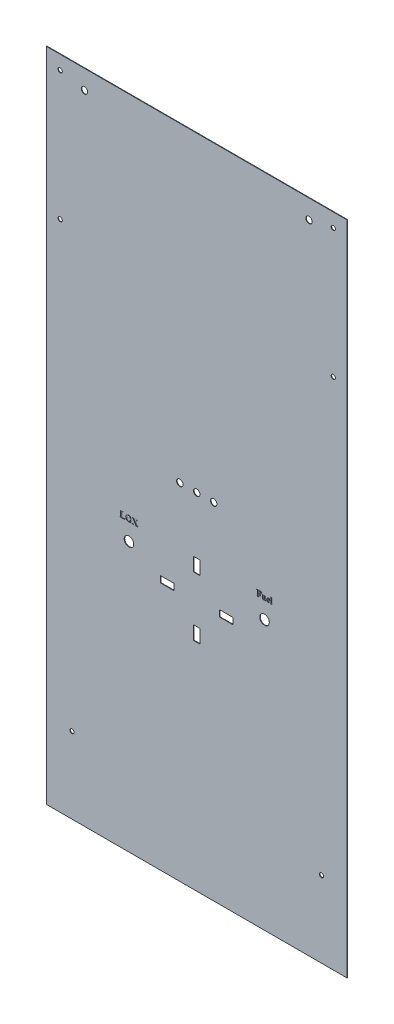
from build123d import *

# Parameters (mm, degrees)
SKETCH1_W           = 901.7
SKETCH1_H           = 1968.5
SKETCH1_R           = 6.35
BOSS_EXTRUDE1_DEPTH = 1.5875
SKETCH2_R           = 14.2875
SKETCH2_W           = 19.05
SKETCH2_H           = 40.64
SKETCH2_W_2         = 40.64
SKETCH2_H_2         = 19.05
CUT_EXTRUDE1_DEPTH  = 1083.597018819
WRAP1_START         = -3.81
WRAP1_DEPTH         = 1.27
SKETCH4_R           = 9.525
CUT_EXTRUDE4_DEPTH  = 22.86
SKETCH6_R           = 9.525
CUT_EXTRUDE5_DEPTH  = 2.54


# Read off the part's stored shape, not the designer's step: Wrap1
with BuildPart() as part:
    # Sketch1 → Boss-Extrude1 (new body)
    with BuildSketch(Plane.XY):
        Rectangle(SKETCH1_W, SKETCH1_H)
        with Locations((-409.447415534, 942.65240495)):
            Circle(SKETCH1_R, mode=Mode.SUBTRACT)
        with Locations((-409.447415534, 555.94759505)):
            Circle(SKETCH1_R, mode=Mode.SUBTRACT)
        with Locations((-374.018387972, -755.65)):
            Circle(SKETCH1_R, mode=Mode.SUBTRACT)
        with Locations(Location((374.018387972, -755.65, 0), (0, 0, 180))):
            Circle(SKETCH1_R, mode=Mode.SUBTRACT)
        with Locations(Location((409.447415534, 555.94759505, 0), (0, 0, 180))):
            Circle(SKETCH1_R, mode=Mode.SUBTRACT)
        with Locations(Location((409.447415534, 942.65240495, 0), (0, 0, 180))):
            Circle(SKETCH1_R, mode=Mode.SUBTRACT)
    extrude(amount=BOSS_EXTRUDE1_DEPTH)

    # Sketch2 → Cut-Extrude1 (cut, through all)
    with BuildSketch(Plane(origin=(0, 0, 0), x_dir=(-1, 0, 0), z_dir=(0, 0, -1))):
        with Locations((203.2, -177.8)):
            Circle(SKETCH2_R)
        with Locations((-203.2, -177.8)):
            Circle(SKETCH2_R)
        with Locations((0, -139.7)):
            Rectangle(SKETCH2_W, SKETCH2_H)
        with Locations((-88.9, -228.6)):
            Rectangle(SKETCH2_W_2, SKETCH2_H_2)
        with Locations((88.9, -228.6)):
            Rectangle(SKETCH2_W_2, SKETCH2_H_2)
        with Locations((0, -317.5)):
            Rectangle(SKETCH2_W, SKETCH2_H)
    extrude(amount=-CUT_EXTRUDE1_DEPTH, mode=Mode.SUBTRACT)

    # Wrap1 outline → Wrap1 (cut)
    # profile 1 of 7: a face of its own
    with BuildSketch(Plane.XY.offset(4.1275).offset(WRAP1_START)):
        with BuildLine():
            add(Edge.make_bspline(
                [(-229.753426043, -126.522165256), (-229.636237529, -126.519976219), (-229.41317649, -126.515809523), (-229.09617467, -126.466288885), (-228.813209456, -126.387863271), (-228.646163395, -126.304456099), (-228.566305351, -126.264582464)],
                knots=[0, 0, 0, 0, 0.286116983, 0.54460586, 0.782294265, 1, 1, 1, 1], degree=3))
            Line((-229.753426043, -126.522165256), (-230.317121718, -126.522165256))
            Line((-230.317121718, -126.522165256), (-230.317121718, -127))
            Line((-230.317121718, -127), (-215.265327284, -127))
            Line((-215.265327284, -127), (-214.548575168, -120.788148329))
            Line((-214.548575168, -120.788148329), (-215.026409912, -120.788148329))
            add(Edge.make_bspline(
                [(-220.151934157, -125.80541314), (-219.932562836, -125.800281899), (-219.510508502, -125.790409766), (-218.907320259, -125.698872442), (-218.358302074, -125.557162613), (-217.864370172, -125.344330626), (-217.414474169, -125.065851051), (-217.002301016, -124.717785385), (-216.620132883, -124.304052356), (-216.331879217, -123.906660058), (-216.11791995, -123.547865792), (-215.951997015, -123.245314942), (-215.794334863, -122.908249637), (-215.632393068, -122.54506771), (-215.481375396, -122.148092083), (-215.322503972, -121.724083219), (-215.171391707, -121.266497406), (-215.07550252, -120.950123175), (-215.026409912, -120.788148329)],
                knots=[0, 0, 0, 0, 0.083692486, 0.161018205, 0.232346257, 0.299586786, 0.365500353, 0.433621102, 0.504882686, 0.580041871, 0.620531465, 0.664319798, 0.71170201, 0.762539634, 0.816086004, 0.873798358, 0.935388254, 1, 1, 1, 1], degree=3))
            Line((-220.151934157, -125.80541314), (-221.585438389, -125.80541314))
            add(Edge.make_bspline(
                [(-223.119735887, -125.693420622), (-223.047852608, -125.711296101), (-222.870193417, -125.755475265), (-222.540067551, -125.779019781), (-222.101040503, -125.803347996), (-221.769696871, -125.804675129), (-221.585438389, -125.80541314)],
                knots=[0, 0, 0, 0, 0.143896066, 0.355638461, 0.641673878, 1, 1, 1, 1], degree=3))
            add(Edge.make_bspline(
                [(-223.866352675, -123.498367267), (-223.865392, -123.601652345), (-223.863551432, -123.799537588), (-223.856493191, -124.080826647), (-223.844815466, -124.333432834), (-223.832218453, -124.555332016), (-223.808811963, -124.748212218), (-223.783249281, -124.91138468), (-223.756011668, -125.047332218), (-223.70606115, -125.185917292), (-223.625445227, -125.332812904), (-223.491822327, -125.481418383), (-223.318626353, -125.601331533), (-223.187975318, -125.661824804), (-223.119735887, -125.693420622)],
                knots=[0, 0, 0, 0, 0.124219593, 0.237993955, 0.338360787, 0.42835088, 0.505199409, 0.571874059, 0.627062731, 0.671557261, 0.748594982, 0.82701569, 0.909649771, 1, 1, 1, 1], degree=3))
            Line((-223.866352675, -123.498367267), (-223.866352675, -112.664957682))
            add(Edge.make_bspline(
                [(-223.739427821, -111.119460932), (-223.749999809, -111.149146381), (-223.773852692, -111.216123714), (-223.798505966, -111.335239557), (-223.821268807, -111.483376173), (-223.833059635, -111.663254918), (-223.849289377, -111.87085995), (-223.861102616, -112.108602576), (-223.862236444, -112.376276017), (-223.864933293, -112.565412846), (-223.866352675, -112.664957682)],
                knots=[0, 0, 0, 0, 0.06067886, 0.136905735, 0.233920776, 0.349449884, 0.48411048, 0.635389887, 0.808101606, 1, 1, 1, 1], degree=3))
            add(Edge.make_bspline(
                [(-223.261593077, -110.533366754), (-223.310259198, -110.565232512), (-223.409867386, -110.630454278), (-223.538040862, -110.765996793), (-223.649286752, -110.930935983), (-223.708665918, -111.055124151), (-223.739427821, -111.119460932)],
                knots=[0, 0, 0, 0, 0.226387342, 0.463362038, 0.721989949, 1, 1, 1, 1], degree=3))
            add(Edge.make_bspline(
                [(-222.160333316, -110.275783963), (-222.268802824, -110.278119635), (-222.476986966, -110.28260246), (-222.772042924, -110.330870623), (-223.035001757, -110.410815629), (-223.188015126, -110.493572376), (-223.261593077, -110.533366754)],
                knots=[0, 0, 0, 0, 0.284002636, 0.54508263, 0.781248603, 1, 1, 1, 1], degree=3))
            Line((-222.160333316, -110.275783963), (-221.477178955, -110.275783963))
            Line((-221.477178955, -110.275783963), (-221.477178955, -109.797949219))
            Line((-221.477178955, -109.797949219), (-230.317121718, -109.797949219))
            Line((-230.317121718, -109.797949219), (-230.317121718, -110.275783963))
            Line((-230.317121718, -110.275783963), (-229.753426043, -110.275783963))
            add(Edge.make_bspline(
                [(-227.927947998, -112.664957682), (-227.929376487, -112.564168786), (-227.932110034, -112.371299754), (-227.933119221, -112.09740266), (-227.945249249, -111.853456485), (-227.960174603, -111.640682081), (-227.976466296, -111.455801376), (-228.004528872, -111.302130434), (-228.026816696, -111.175687487), (-228.073793401, -111.049072991), (-228.148610431, -110.910709437), (-228.275397871, -110.764872143), (-228.434574129, -110.630147904), (-228.626451322, -110.505917808), (-228.855303867, -110.400345023), (-229.122678716, -110.328270983), (-229.42585248, -110.282806886), (-229.64000416, -110.27821564), (-229.753426043, -110.275783963)],
                knots=[0, 0, 0, 0, 0.084622749, 0.161933587, 0.22990784, 0.289599081, 0.34105252, 0.385532842, 0.420773186, 0.448530112, 0.498553263, 0.551922288, 0.609709232, 0.67316662, 0.743282504, 0.820338844, 0.90484545, 1, 1, 1, 1], degree=3))
            Line((-227.927947998, -112.664957682), (-227.927947998, -124.132991536))
            add(Edge.make_bspline(
                [(-228.066072104, -125.678488286), (-228.053878904, -125.648919223), (-228.026103286, -125.581562086), (-228.005452117, -125.460770969), (-227.975507496, -125.313738641), (-227.960396653, -125.134824087), (-227.945152957, -124.925847451), (-227.933270797, -124.688097364), (-227.932024686, -124.420430161), (-227.929359829, -124.232536736), (-227.927947998, -124.132991536)],
                knots=[0, 0, 0, 0, 0.061394352, 0.139853863, 0.234760276, 0.350352995, 0.484827155, 0.638289672, 0.808367287, 1, 1, 1, 1], degree=3))
            add(Edge.make_bspline(
                [(-228.566305351, -126.264582464), (-228.513841635, -126.232933684), (-228.407719614, -126.168915485), (-228.271425976, -126.033307564), (-228.155927585, -125.868003182), (-228.096632758, -125.742944001), (-228.066072104, -125.678488286)],
                knots=[0, 0, 0, 0, 0.23335888, 0.472031298, 0.72788403, 1, 1, 1, 1], degree=3))
        make_face()
    # profile 2 of 7: a face of its own
    with BuildSketch(Plane.XY.offset(4.1275).offset(WRAP1_START)):
        with BuildLine():
            add(Edge.make_bspline(
                [(-194.718433295, -118.260850504), (-194.724017479, -118.527395433), (-194.735035576, -119.053312496), (-194.827203283, -119.829949656), (-194.977372559, -120.582130209), (-195.180608052, -121.312966858), (-195.451068619, -122.017123582), (-195.783231756, -122.69419378), (-196.164460973, -123.35329381), (-196.468850095, -123.762458061), (-196.622306103, -123.968735843)],
                knots=[0, 0, 0, 0, 0.130405832, 0.257302407, 0.382101033, 0.505478704, 0.628069418, 0.750625341, 0.874279213, 1, 1, 1, 1], degree=3))
            add(Edge.make_bspline(
                [(-203.909285948, -109.559031847), (-203.576856146, -109.553848597), (-202.926775912, -109.543712539), (-201.973128758, -109.637324107), (-201.066575694, -109.807149904), (-200.206609472, -110.059482945), (-199.398043873, -110.403407626), (-198.634697098, -110.827047087), (-197.919622082, -111.336565182), (-197.261501448, -111.926383685), (-196.66864867, -112.576115942), (-196.145231314, -113.269846968), (-195.70250353, -114.003776103), (-195.342394477, -114.778877827), (-195.06002235, -115.592766401), (-194.864971074, -116.447883307), (-194.741519452, -117.341405333), (-194.726223502, -117.950592369), (-194.718433295, -118.260850504)],
                knots=[0, 0, 0, 0, 0.069849949, 0.136594465, 0.20103729, 0.263531056, 0.324607527, 0.385387455, 0.446727247, 0.508796852, 0.570828957, 0.631365177, 0.691215795, 0.75067175, 0.810735822, 0.87197288, 0.934795961, 1, 1, 1, 1], degree=3))
            add(Edge.make_bspline(
                [(-212.876153564, -118.272049756), (-212.868157043, -117.961837627), (-212.852455997, -117.352740923), (-212.731856278, -116.457996138), (-212.525783502, -115.604326355), (-212.240446011, -114.788989394), (-211.87789791, -114.011937584), (-211.430577993, -113.276279528), (-210.899609784, -112.582201243), (-210.294740021, -111.934406847), (-209.633428736, -111.3455359), (-208.927659924, -110.831424373), (-208.1808215, -110.409611212), (-207.398487794, -110.06609697), (-206.578639267, -109.807869114), (-205.720070019, -109.63766039), (-204.82597401, -109.543972597), (-204.218086037, -109.553958913), (-203.909285948, -109.559031847)],
                knots=[0, 0, 0, 0, 0.066265956, 0.130112177, 0.192469093, 0.253598737, 0.314376421, 0.375339326, 0.437182314, 0.500765603, 0.564420002, 0.626110784, 0.686953563, 0.747315202, 0.808362113, 0.870201672, 0.934063944, 1, 1, 1, 1], degree=3))
            add(Edge.make_bspline(
                [(-210.882686742, -124.121792285), (-211.041964948, -123.914138898), (-211.358752432, -123.501138302), (-211.765029578, -122.838579483), (-212.106515122, -122.146758921), (-212.387202635, -121.427235156), (-212.608287484, -120.679395853), (-212.764464604, -119.902462731), (-212.860479239, -119.097003096), (-212.870876009, -118.549812049), (-212.876153564, -118.272049756)],
                knots=[0, 0, 0, 0, 0.124469297, 0.247556251, 0.369105337, 0.491161059, 0.614633392, 0.73970266, 0.867869208, 1, 1, 1, 1], degree=3))
            add(Edge.make_bspline(
                [(-203.745030255, -127.238917372), (-203.934245051, -127.237184516), (-204.308079424, -127.233760888), (-204.860990224, -127.193963899), (-205.39821356, -127.136256498), (-205.919316031, -127.05062999), (-206.422649041, -126.9359105), (-206.913431242, -126.809580948), (-207.38332404, -126.64672569), (-207.83756508, -126.462373568), (-208.278052534, -126.25912154), (-208.700899992, -126.027151484), (-209.104515854, -125.767855886), (-209.493225434, -125.487366165), (-209.868142157, -125.18574585), (-210.223166586, -124.854873643), (-210.563395068, -124.500787124), (-210.775787893, -124.248679752), (-210.882686742, -124.121792285)],
                knots=[0, 0, 0, 0, 0.070311969, 0.138916362, 0.205924571, 0.271084613, 0.335043637, 0.397754782, 0.459328336, 0.519703925, 0.579914551, 0.639525377, 0.698797951, 0.758099388, 0.817616847, 0.877506899, 0.938348334, 1, 1, 1, 1], degree=3))
            add(Edge.make_bspline(
                [(-196.622306103, -123.968735843), (-196.728949032, -124.102023109), (-196.940164733, -124.366010264), (-197.283101614, -124.734937967), (-197.635197756, -125.084869872), (-198.011845907, -125.40091671), (-198.399119001, -125.697042327), (-198.803860249, -125.967274303), (-199.225970337, -126.209236136), (-199.663398873, -126.426575744), (-200.117876159, -126.616624885), (-200.586542788, -126.786275217), (-201.075280584, -126.922569372), (-201.578199328, -127.039072591), (-202.097972362, -127.128677976), (-202.632721999, -127.190039728), (-203.183066067, -127.234871185), (-203.555792531, -127.237554845), (-203.745030255, -127.238917372)],
                knots=[0, 0, 0, 0, 0.062892078, 0.124563294, 0.185534769, 0.245726785, 0.305624548, 0.365154215, 0.424941259, 0.484831998, 0.54505371, 0.606415486, 0.668404777, 0.731930775, 0.796623147, 0.862668568, 0.930275174, 1, 1, 1, 1], degree=3))
        make_face()
        with BuildLine():
            add(Edge.make_bspline(
                [(-207.336257002, -112.877743467), (-207.418011601, -113.046803464), (-207.587222221, -113.396713404), (-207.782425416, -113.966883133), (-207.955597854, -114.586083402), (-208.096394776, -115.258230894), (-208.202657758, -115.983986359), (-208.279731821, -116.761310103), (-208.329848235, -117.590726366), (-208.334386685, -118.161225378), (-208.336723497, -118.454970868)],
                knots=[0, 0, 0, 0, 0.098492955, 0.203854633, 0.315738249, 0.435901004, 0.564024753, 0.700575662, 0.845828744, 1, 1, 1, 1], degree=3))
            add(Edge.make_bspline(
                [(-203.759962591, -110.514701335), (-203.950981852, -110.521329236), (-204.32403358, -110.534273219), (-204.864161608, -110.651635695), (-205.370511851, -110.832833113), (-205.839443614, -111.097103002), (-206.275888465, -111.429981496), (-206.669491416, -111.845337128), (-207.030434857, -112.329324537), (-207.232117168, -112.690993562), (-207.336257002, -112.877743467)],
                knots=[0, 0, 0, 0, 0.126292685, 0.246643735, 0.364165419, 0.481050344, 0.601480292, 0.726142767, 0.858592225, 1, 1, 1, 1], degree=3))
            add(Edge.make_bspline(
                [(-199.257863363, -118.555764135), (-199.260150236, -118.28570862), (-199.264577899, -117.762848584), (-199.294598316, -117.004720651), (-199.342354753, -116.298778745), (-199.408046938, -115.644744856), (-199.495249504, -115.0437181), (-199.610124055, -114.49664799), (-199.731670696, -113.999601347), (-199.883973099, -113.55448585), (-200.051568333, -113.153189474), (-200.220491672, -112.780337458), (-200.40937288, -112.442418253), (-200.600277353, -112.129008589), (-200.81201909, -111.85395378), (-201.027892107, -111.603286144), (-201.259982249, -111.387840569), (-201.578216058, -111.139023945), (-202.003960149, -110.884710985), (-202.557457648, -110.672459309), (-203.145997012, -110.53477257), (-203.552612772, -110.521479837), (-203.759962591, -110.514701335)],
                knots=[0, 0, 0, 0, 0.078235768, 0.15147388, 0.219769184, 0.283189358, 0.341871029, 0.39560353, 0.44509179, 0.490008293, 0.531715711, 0.571069594, 0.608500784, 0.643809453, 0.677264075, 0.708938794, 0.739545141, 0.768823346, 0.825888193, 0.882390021, 0.940025916, 1, 1, 1, 1], degree=3))
            add(Edge.make_bspline(
                [(-201.609706243, -125.659822867), (-201.518910442, -125.590370406), (-201.334389107, -125.449224443), (-201.075831196, -125.206206225), (-200.838968032, -124.92773117), (-200.61305054, -124.624253287), (-200.404645933, -124.290370142), (-200.209378265, -123.928329827), (-200.036400501, -123.533280409), (-199.869397069, -123.111498101), (-199.726283579, -122.655643678), (-199.596770806, -122.168011215), (-199.496883696, -121.645799464), (-199.404119426, -121.092516696), (-199.339843069, -120.505377496), (-199.289895411, -119.885502452), (-199.266084208, -119.231633965), (-199.260648465, -118.784738968), (-199.257863363, -118.555764135)],
                knots=[0, 0, 0, 0, 0.044242423, 0.089912429, 0.137048047, 0.185612229, 0.236272384, 0.289296534, 0.344719967, 0.403142498, 0.464849718, 0.529587621, 0.598372434, 0.670607157, 0.746741958, 0.826962138, 0.911340884, 1, 1, 1, 1], degree=3))
            add(Edge.make_bspline(
                [(-203.786094178, -126.283247884), (-203.577534203, -126.277488771), (-203.174112894, -126.266348815), (-202.597987697, -126.140658338), (-202.068139274, -125.953526382), (-201.760935203, -125.756710469), (-201.609706243, -125.659822867)],
                knots=[0, 0, 0, 0, 0.271629072, 0.525416998, 0.766374536, 1, 1, 1, 1], degree=3))
            add(Edge.make_bspline(
                [(-206.794959831, -124.838544401), (-206.703104717, -124.954220234), (-206.52357018, -125.180313328), (-206.21090486, -125.474389772), (-205.875288692, -125.728431585), (-205.505384156, -125.927398468), (-205.115500528, -126.09224697), (-204.695677531, -126.202467996), (-204.250044979, -126.271235548), (-203.943147012, -126.279181566), (-203.786094178, -126.283247884)],
                knots=[0, 0, 0, 0, 0.12750736, 0.249218294, 0.369884192, 0.490218952, 0.611248533, 0.734906211, 0.864340154, 1, 1, 1, 1], degree=3))
            add(Edge.make_bspline(
                [(-208.336723497, -118.454970868), (-208.333476883, -118.803555521), (-208.327195784, -119.477948657), (-208.249358748, -120.453508534), (-208.133703357, -121.359168115), (-207.967016958, -122.194241479), (-207.751395889, -122.960169556), (-207.48801407, -123.655909283), (-207.176706047, -124.284764584), (-206.920066783, -124.657058109), (-206.794959831, -124.838544401)],
                knots=[0, 0, 0, 0, 0.156670188, 0.303103704, 0.439658844, 0.566921389, 0.685563365, 0.796936138, 0.901010077, 1, 1, 1, 1], degree=3))
        make_face(mode=Mode.SUBTRACT)
    # profile 3 of 7: a face of its own
    with BuildSketch(Plane.XY.offset(4.1275).offset(WRAP1_START)):
        with BuildLine():
            add(Edge.make_bspline(
                [(-178.315262477, -123.901540332), (-178.220954099, -124.042332192), (-178.040973638, -124.311022891), (-177.780417607, -124.691101697), (-177.542567801, -125.028886613), (-177.321117656, -125.319631326), (-177.124841845, -125.569878388), (-176.950043375, -125.777286062), (-176.794414717, -125.938631232), (-176.614360473, -126.095060742), (-176.388000485, -126.240639613), (-176.102705495, -126.377493649), (-175.792360898, -126.470692124), (-175.576923504, -126.504766569), (-175.466919433, -126.522165256)],
                knots=[0, 0, 0, 0, 0.126497608, 0.241411193, 0.343994715, 0.434841881, 0.514196246, 0.581398797, 0.637233328, 0.681363404, 0.759169511, 0.837285515, 0.916916671, 1, 1, 1, 1], degree=3))
            Line((-178.315262477, -123.901540332), (-182.847226376, -117.058797476))
            Line((-182.847226376, -117.058797476), (-179.67410503, -113.116660839))
            add(Edge.make_bspline(
                [(-178.035281181, -111.138126352), (-178.067911162, -111.171467294), (-178.144929118, -111.250163361), (-178.270668934, -111.394301992), (-178.43270684, -111.576080202), (-178.621005906, -111.804397521), (-178.841537657, -112.072940804), (-179.091408658, -112.383005643), (-179.372355461, -112.735384894), (-179.569662217, -112.984692027), (-179.67410503, -113.116660839)],
                knots=[0, 0, 0, 0, 0.054447391, 0.128514533, 0.223210912, 0.338706703, 0.473921181, 0.62886415, 0.803542095, 1, 1, 1, 1], degree=3))
            add(Edge.make_bspline(
                [(-175.870092498, -110.275783963), (-175.988388839, -110.28054247), (-176.213111938, -110.289582027), (-176.53193173, -110.325021943), (-176.814061909, -110.385280788), (-177.069543497, -110.463935091), (-177.309766105, -110.576399345), (-177.5452197, -110.730779986), (-177.792284414, -110.916455595), (-177.951864525, -111.062030552), (-178.035281181, -111.138126352)],
                knots=[0, 0, 0, 0, 0.147897503, 0.280955311, 0.400178886, 0.507855505, 0.614267687, 0.73028563, 0.859013314, 1, 1, 1, 1], degree=3))
            Line((-175.870092498, -110.275783963), (-175.870092498, -109.797949219))
            Line((-175.870092498, -109.797949219), (-182.283530702, -109.797949219))
            Line((-182.283530702, -109.797949219), (-182.283530702, -110.275783963))
            add(Edge.make_bspline(
                [(-180.394590229, -111.526367082), (-180.403774393, -111.415123672), (-180.422240277, -111.191455202), (-180.57988662, -110.882221614), (-180.818105816, -110.61362874), (-181.096798512, -110.451322452), (-181.369936212, -110.360529529), (-181.630665232, -110.309534589), (-181.94074642, -110.282292916), (-182.16401731, -110.278053341), (-182.283530702, -110.275783963)],
                knots=[0, 0, 0, 0, 0.130173209, 0.261729146, 0.399541564, 0.547861549, 0.634397953, 0.737427191, 0.859448911, 1, 1, 1, 1], degree=3))
            add(Edge.make_bspline(
                [(-181.77956437, -113.919273885), (-181.670165064, -113.783270081), (-181.462006767, -113.524490375), (-181.183403562, -113.142693233), (-180.942598204, -112.797280643), (-180.746913136, -112.482078866), (-180.592210352, -112.200149806), (-180.481139557, -111.948754979), (-180.412179484, -111.727798585), (-180.400053988, -111.588937844), (-180.394590229, -111.526367082)],
                knots=[0, 0, 0, 0, 0.187080214, 0.355964768, 0.50655841, 0.638342089, 0.753533152, 0.850920003, 0.932824433, 1, 1, 1, 1], degree=3))
            Line((-181.77956437, -113.919273885), (-183.504249149, -116.062064065))
            Line((-183.504249149, -116.062064065), (-185.609708489, -112.885209635))
            Line((-185.609708489, -112.885209635), (-186.479517047, -111.574897173))
            add(Edge.make_bspline(
                [(-186.565377977, -111.093329345), (-186.562378123, -111.181261317), (-186.556756568, -111.34604082), (-186.504082454, -111.502111254), (-186.479517047, -111.574897173)],
                knots=[0, 0, 0, 0, 0.533634166, 1, 1, 1, 1], degree=3))
            add(Edge.make_bspline(
                [(-185.258798599, -110.275783963), (-185.37104042, -110.27798624), (-185.579143812, -110.282069401), (-185.863294114, -110.327280866), (-186.098857514, -110.391690812), (-186.275812465, -110.500759486), (-186.407129066, -110.626867808), (-186.500166643, -110.768269442), (-186.554446759, -110.926544536), (-186.561681095, -111.036923576), (-186.565377977, -111.093329345)],
                knots=[0, 0, 0, 0, 0.193798871, 0.359315288, 0.49675642, 0.612601935, 0.714528736, 0.809401167, 0.902600404, 1, 1, 1, 1], degree=3))
            Line((-185.258798599, -110.275783963), (-184.829493946, -110.275783963))
            Line((-184.829493946, -110.275783963), (-184.829493946, -109.797949219))
            Line((-184.829493946, -109.797949219), (-193.221466637, -109.797949219))
            Line((-193.221466637, -109.797949219), (-193.221466637, -110.275783963))
            add(Edge.make_bspline(
                [(-191.646105215, -111.134393268), (-191.700723502, -111.068399346), (-191.804776639, -110.94267452), (-191.976203892, -110.781825301), (-192.140999932, -110.645457869), (-192.314779915, -110.541253063), (-192.499368964, -110.450303007), (-192.714520602, -110.384128408), (-192.956368151, -110.317695745), (-193.130245394, -110.290205942), (-193.221466637, -110.275783963)],
                knots=[0, 0, 0, 0, 0.138951375, 0.264715855, 0.381158651, 0.485468856, 0.593016643, 0.714420306, 0.850176286, 1, 1, 1, 1], degree=3))
            add(Edge.make_bspline(
                [(-190.425386768, -112.892675802), (-190.510008736, -112.76824351), (-190.66916105, -112.53421814), (-190.893644324, -112.203950584), (-191.090125143, -111.919755069), (-191.2558718, -111.677666631), (-191.393563225, -111.479483765), (-191.504256651, -111.326045529), (-191.583346182, -111.213936229), (-191.628526414, -111.156673246), (-191.646105215, -111.134393268)],
                knots=[0, 0, 0, 0, 0.210884309, 0.396619539, 0.559630646, 0.695069056, 0.807787606, 0.897795021, 0.960233914, 1, 1, 1, 1], degree=3))
            Line((-190.425386768, -112.892675802), (-186.15100566, -119.347177929))
            Line((-186.15100566, -119.347177929), (-189.484649616, -123.487168015))
            add(Edge.make_bspline(
                [(-191.84022558, -125.913672574), (-191.766050175, -125.859885825), (-191.606062475, -125.743874079), (-191.366058271, -125.535878004), (-191.099990605, -125.294138782), (-190.816694507, -125.0094193), (-190.515967961, -124.681894349), (-190.185947113, -124.322032296), (-189.840526286, -123.918365216), (-189.606143705, -123.634376066), (-189.484649616, -123.487168015)],
                knots=[0, 0, 0, 0, 0.081036263, 0.17478577, 0.280771193, 0.39911038, 0.529989712, 0.674191297, 0.831114449, 1, 1, 1, 1], degree=3))
            add(Edge.make_bspline(
                [(-193.605974282, -126.522165256), (-193.428475542, -126.492064393), (-193.090058547, -126.434674445), (-192.617066321, -126.297633403), (-192.196800775, -126.137494655), (-191.955258099, -125.985878432), (-191.84022558, -125.913672574)],
                knots=[0, 0, 0, 0, 0.286640828, 0.546506005, 0.784027577, 1, 1, 1, 1], degree=3))
            Line((-193.605974282, -126.522165256), (-193.605974282, -127))
            Line((-193.605974282, -127), (-186.901355531, -127))
            Line((-186.901355531, -127), (-186.901355531, -126.522165256))
            add(Edge.make_bspline(
                [(-187.983949873, -126.451236661), (-187.92808433, -126.462106428), (-187.794865981, -126.488026741), (-187.557390939, -126.506108324), (-187.252494845, -126.5219491), (-187.025831792, -126.52208863), (-186.901355531, -126.522165256)],
                knots=[0, 0, 0, 0, 0.157013586, 0.374418457, 0.65645018, 1, 1, 1, 1], degree=3))
            add(Edge.make_bspline(
                [(-189.182269817, -125.357443068), (-189.178851806, -125.416422899), (-189.172072093, -125.53341092), (-189.110462365, -125.705148863), (-189.013051414, -125.867543086), (-188.879299513, -126.022595825), (-188.710655866, -126.166853091), (-188.499640293, -126.282553785), (-188.255487944, -126.382385117), (-188.078006956, -126.427387426), (-187.983949873, -126.451236661)],
                knots=[0, 0, 0, 0, 0.100751351, 0.199842915, 0.30878505, 0.423694858, 0.549243335, 0.686728538, 0.833979966, 1, 1, 1, 1], degree=3))
            add(Edge.make_bspline(
                [(-188.010081461, -123.468502596), (-188.103204143, -123.578415982), (-188.279522639, -123.786526001), (-188.514294387, -124.09516081), (-188.716886225, -124.372651741), (-188.880348063, -124.624214005), (-189.016057474, -124.842408939), (-189.104691846, -125.038941749), (-189.167747871, -125.205610863), (-189.177829475, -125.311017685), (-189.182269817, -125.357443068)],
                knots=[0, 0, 0, 0, 0.192150646, 0.363818055, 0.517241748, 0.650310056, 0.764194402, 0.859271298, 0.938017447, 1, 1, 1, 1], degree=3))
            Line((-188.010081461, -123.468502596), (-185.493982887, -120.340178257))
            Line((-185.493982887, -120.340178257), (-183.175737762, -123.841810989))
            add(Edge.make_bspline(
                [(-182.294729953, -125.256649801), (-182.333521799, -125.178930532), (-182.426187099, -124.993276065), (-182.619758612, -124.684435407), (-182.871831428, -124.288855042), (-183.067842083, -124.000524766), (-183.175737762, -123.841810989)],
                knots=[0, 0, 0, 0, 0.156153027, 0.373015693, 0.654871322, 1, 1, 1, 1], degree=3))
            add(Edge.make_bspline(
                [(-182.208869023, -125.663555951), (-182.212308373, -125.590514532), (-182.218918647, -125.450132254), (-182.270153016, -125.319374036), (-182.294729953, -125.256649801)],
                knots=[0, 0, 0, 0, 0.520303695, 1, 1, 1, 1], degree=3))
            add(Edge.make_bspline(
                [(-183.78049736, -126.522165256), (-183.62973452, -126.507746945), (-183.3557518, -126.481544413), (-182.988379234, -126.422634598), (-182.706918014, -126.34236816), (-182.505315768, -126.234799413), (-182.371657244, -126.106352373), (-182.274562777, -125.9723012), (-182.220308703, -125.820433904), (-182.212708266, -125.716205383), (-182.208869023, -125.663555951)],
                knots=[0, 0, 0, 0, 0.22952437, 0.417116787, 0.563269803, 0.671351673, 0.759411843, 0.842075566, 0.920226904, 1, 1, 1, 1], degree=3))
            Line((-183.78049736, -126.522165256), (-183.78049736, -127))
            Line((-183.78049736, -127), (-175.466919433, -127))
            Line((-175.466919433, -127), (-175.466919433, -126.522165256))
        make_face()
    # profile 4 of 7: a face of its own
    with BuildSketch(Plane.XY.offset(4.1275).offset(WRAP1_START)):
        with BuildLine():
            add(Edge.make_bspline(
                [(225.897150336, -124.371908908), (225.89779293, -124.478935376), (225.899018732, -124.683097566), (225.910148184, -124.974412762), (225.928150444, -125.235967251), (225.953767852, -125.466429096), (225.985672624, -125.667875825), (226.030754716, -125.836986712), (226.077542972, -125.978284731), (226.152056385, -126.125592134), (226.286821706, -126.274708238), (226.505716323, -126.402368284), (226.780484112, -126.485826486), (226.982878765, -126.509456044), (227.091737196, -126.522165256)],
                knots=[0, 0, 0, 0, 0.113303814, 0.216136768, 0.308589519, 0.390787078, 0.461608663, 0.524237009, 0.575901825, 0.618914388, 0.6982322, 0.78453931, 0.884113971, 1, 1, 1, 1], degree=3))
            Line((225.897150336, -124.371908908), (225.897150336, -109.797949219))
            Line((225.897150336, -109.797949219), (221.118802897, -109.797949219))
            Line((221.118802897, -109.797949219), (221.118802897, -110.275783963))
            add(Edge.make_bspline(
                [(222.313389757, -112.42604031), (222.312711865, -112.319019474), (222.311418729, -112.114868025), (222.300788763, -111.824721152), (222.281474139, -111.564634085), (222.258992353, -111.33456812), (222.218104833, -111.135078672), (222.18235245, -110.963141627), (222.128237881, -110.824214327), (222.055408195, -110.675778042), (221.91875454, -110.527441679), (221.703421231, -110.395520993), (221.428802406, -110.3118181), (221.227634815, -110.288434512), (221.118802897, -110.275783963)],
                knots=[0, 0, 0, 0, 0.113475465, 0.216464207, 0.307741029, 0.390063115, 0.461224767, 0.523628009, 0.575823302, 0.618901027, 0.698339003, 0.785468901, 0.883938407, 1, 1, 1, 1], degree=3))
            Line((222.313389757, -112.42604031), (222.313389757, -124.371908908))
            add(Edge.make_bspline(
                [(222.100603973, -126.03313126), (222.117659052, -126.002426672), (222.156537167, -125.93243365), (222.199031444, -125.803696314), (222.235040733, -125.643622125), (222.264353755, -125.451474495), (222.286208578, -125.227171483), (222.299234716, -124.970542076), (222.311920293, -124.681873132), (222.31288234, -124.478941952), (222.313389757, -124.371908908)],
                knots=[0, 0, 0, 0, 0.062274042, 0.141957556, 0.239524505, 0.353613935, 0.486876676, 0.639624286, 0.809925169, 1, 1, 1, 1], degree=3))
            add(Edge.make_bspline(
                [(221.118802897, -126.522165256), (221.222937791, -126.512967248), (221.420694176, -126.495499859), (221.694726847, -126.399501839), (221.929352913, -126.247804202), (222.043116973, -126.105194483), (222.100603973, -126.03313126)],
                knots=[0, 0, 0, 0, 0.274716901, 0.521698533, 0.75830578, 1, 1, 1, 1], degree=3))
            Line((221.118802897, -126.522165256), (221.118802897, -127))
            Line((221.118802897, -127), (227.091737196, -127))
            Line((227.091737196, -127), (227.091737196, -126.522165256))
        make_face()
    # profile 5 of 7: a face of its own
    with BuildSketch(Plane.XY.offset(4.1275).offset(WRAP1_START)):
        with BuildLine():
            add(Edge.make_bspline(
                [(213.473446994, -120.788148329), (213.484435832, -120.960148917), (213.505943609, -121.29679511), (213.583114555, -121.786676721), (213.684978238, -122.249040656), (213.821703415, -122.682893581), (213.983799397, -123.090003948), (214.180318154, -123.468878969), (214.401634918, -123.824018593), (214.579570657, -124.035377647), (214.668033854, -124.140457704)],
                knots=[0, 0, 0, 0, 0.142498601, 0.278903765, 0.409754711, 0.533792625, 0.654786412, 0.771718901, 0.886506916, 1, 1, 1, 1], degree=3))
            Line((213.473446994, -120.788148329), (219.685298665, -120.788148329))
            add(Edge.make_bspline(
                [(215.186932521, -115.054131402), (215.332744169, -115.058510463), (215.622200037, -115.067203493), (216.048806762, -115.134412784), (216.458018259, -115.253112742), (216.855015559, -115.409736193), (217.234216931, -115.616447449), (217.601105015, -115.865873655), (217.951321342, -116.161091595), (218.283547274, -116.50245011), (218.594544826, -116.883472124), (218.86336233, -117.315423435), (219.099552053, -117.785633618), (219.293677172, -118.302842174), (219.448696858, -118.86284987), (219.567373822, -119.466872314), (219.649949143, -120.112981811), (219.673298611, -120.558950461), (219.685298665, -120.788148329)],
                knots=[0, 0, 0, 0, 0.053851778, 0.106903072, 0.158993774, 0.210976872, 0.264244788, 0.318174982, 0.374616845, 0.433126587, 0.493931417, 0.555909881, 0.620664302, 0.688022464, 0.759624451, 0.835078572, 0.915241487, 1, 1, 1, 1], degree=3))
            add(Edge.make_bspline(
                [(209.889686415, -121.336911668), (209.894719185, -121.10276357), (209.90454369, -120.645681529), (209.980594115, -119.978999285), (210.102613191, -119.349353239), (210.2741664, -118.754968824), (210.497535894, -118.198065108), (210.772958134, -117.678469985), (211.094379424, -117.194692575), (211.463511022, -116.751469289), (211.868601015, -116.356868909), (212.289861517, -116.006538666), (212.730381362, -115.712693562), (213.188089446, -115.471799928), (213.664038535, -115.28490749), (214.156563033, -115.148604378), (214.666675717, -115.069113443), (215.012450108, -115.059156041), (215.186932521, -115.054131402)],
                knots=[0, 0, 0, 0, 0.076562623, 0.149458401, 0.21913521, 0.286105541, 0.351475226, 0.415010164, 0.478105644, 0.541102612, 0.603263254, 0.662822278, 0.720048412, 0.77611527, 0.831661283, 0.886950275, 0.942953587, 1, 1, 1, 1], degree=3))
            add(Edge.make_bspline(
                [(210.968547673, -125.271582137), (210.88102663, -125.137625359), (210.705153318, -124.868439554), (210.492613936, -124.431055744), (210.303414385, -123.974618269), (210.150153402, -123.492736846), (210.037104595, -122.986250765), (209.948583271, -122.458223958), (209.902174638, -121.905168811), (209.893899387, -121.528616399), (209.889686415, -121.336911668)],
                knots=[0, 0, 0, 0, 0.115803047, 0.23270593, 0.351552617, 0.473563527, 0.598418097, 0.72719374, 0.861112958, 1, 1, 1, 1], degree=3))
            add(Edge.make_bspline(
                [(214.914417394, -127.238917372), (214.703729756, -127.233864665), (214.292610381, -127.224005208), (213.696785522, -127.127513253), (213.13887858, -126.977069211), (212.622985722, -126.757196627), (212.145015008, -126.480466919), (211.707965539, -126.139364108), (211.30691038, -125.738898373), (211.082697561, -125.429235729), (210.968547673, -125.271582137)],
                knots=[0, 0, 0, 0, 0.137204424, 0.267729979, 0.392271254, 0.512917972, 0.632116942, 0.751180664, 0.873322589, 1, 1, 1, 1], degree=3))
            add(Edge.make_bspline(
                [(219.685298665, -123.416239421), (219.605780294, -123.584895446), (219.451712401, -123.911668717), (219.204794229, -124.376907407), (218.950341491, -124.801946302), (218.694303997, -125.193874332), (218.424581023, -125.543359165), (218.15255458, -125.859695507), (217.873300421, -126.136028928), (217.586567255, -126.375587228), (217.288999838, -126.576118976), (216.984868778, -126.755089568), (216.667742744, -126.902249872), (216.340858213, -127.028855322), (216.000030954, -127.120331824), (215.648204292, -127.18765311), (215.285001608, -127.229779755), (215.038965215, -127.235846355), (214.914417394, -127.238917372)],
                knots=[0, 0, 0, 0, 0.085828138, 0.166293149, 0.242330062, 0.313823047, 0.381648941, 0.445397375, 0.505750891, 0.562298265, 0.617113102, 0.670757122, 0.724569091, 0.777869471, 0.831927831, 0.886751647, 0.942671751, 1, 1, 1, 1], degree=3))
            Line((219.685298665, -123.416239421), (219.255994013, -123.177322049))
            add(Edge.make_bspline(
                [(216.672699928, -125.088661024), (216.791421251, -125.083974405), (217.025324331, -125.074740892), (217.365670203, -124.991010226), (217.691516567, -124.865737813), (218.002764023, -124.673953047), (218.310747805, -124.415701638), (218.624350768, -124.079404838), (218.942669548, -123.658350097), (219.14729079, -123.344207513), (219.255994013, -123.177322049)],
                knots=[0, 0, 0, 0, 0.105424729, 0.207706318, 0.31005375, 0.414825833, 0.531164543, 0.666607217, 0.822888038, 1, 1, 1, 1], degree=3))
            add(Edge.make_bspline(
                [(214.668033854, -124.140457704), (214.737224099, -124.216910611), (214.87225015, -124.36610988), (215.100832508, -124.556095409), (215.334102487, -124.723587943), (215.583593361, -124.852302243), (215.839535799, -124.960699447), (216.10831747, -125.033406274), (216.387327271, -125.080545548), (216.576688627, -125.085930639), (216.672699928, -125.088661024)],
                knots=[0, 0, 0, 0, 0.134919963, 0.263298817, 0.388576173, 0.510368139, 0.630257589, 0.752082285, 0.87429905, 1, 1, 1, 1], degree=3))
        make_face()
        with BuildLine():
            add(Edge.make_bspline(
                [(215.758094364, -116.21885359), (215.715890545, -116.185464945), (215.631040376, -116.118337554), (215.474479544, -116.057257161), (215.302645961, -116.013317442), (215.179795928, -116.011002805), (215.116003927, -116.00980089)],
                knots=[0, 0, 0, 0, 0.232672174, 0.467784049, 0.723637675, 1, 1, 1, 1], degree=3))
            add(Edge.make_bspline(
                [(216.57937283, -119.832478841), (216.57815544, -119.683164175), (216.575821963, -119.396959862), (216.572034655, -118.984794933), (216.54875463, -118.609325407), (216.535561247, -118.270170354), (216.502716886, -117.96930557), (216.470920622, -117.703778395), (216.432081819, -117.47387069), (216.367082665, -117.223662081), (216.275295191, -116.951215735), (216.135391836, -116.663950962), (215.965533996, -116.416189083), (215.826465873, -116.283894804), (215.758094364, -116.21885359)],
                knots=[0, 0, 0, 0, 0.117461895, 0.225149355, 0.32413075, 0.413337278, 0.492033041, 0.562085029, 0.623719301, 0.675235114, 0.765312701, 0.849359813, 0.925939196, 1, 1, 1, 1], degree=3))
            Line((216.57937283, -119.832478841), (213.473446994, -119.832478841))
            Line((213.473446994, -119.832478841), (213.473446994, -119.425572692))
            add(Edge.make_bspline(
                [(214.145402103, -116.599628152), (214.091434461, -116.688287968), (213.980986667, -116.869735237), (213.844736112, -117.165381535), (213.728537195, -117.483751515), (213.636225129, -117.826357975), (213.561311693, -118.19146538), (213.509581338, -118.581886146), (213.480528455, -118.995820581), (213.475846785, -119.279936775), (213.473446994, -119.425572692)],
                knots=[0, 0, 0, 0, 0.105683126, 0.216286423, 0.330999153, 0.450650361, 0.577463014, 0.710511166, 0.851610106, 1, 1, 1, 1], degree=3))
            add(Edge.make_bspline(
                [(215.116003927, -116.00980089), (215.020260492, -116.016772573), (214.83218273, -116.030467701), (214.565365604, -116.148259392), (214.329499766, -116.339846718), (214.208686654, -116.510326903), (214.145402103, -116.599628152)],
                knots=[0, 0, 0, 0, 0.241168632, 0.473750048, 0.724338765, 1, 1, 1, 1], degree=3))
        make_face(mode=Mode.SUBTRACT)
    # profile 6 of 7: a face of its own
    with BuildSketch(Plane.XY.offset(4.1275).offset(WRAP1_START)):
        with BuildLine():
            add(Edge.make_bspline(
                [(206.783760579, -124.371908908), (206.784395331, -124.481422313), (206.785600291, -124.689313397), (206.796716774, -124.98562686), (206.814858649, -125.249598645), (206.839487333, -125.481578661), (206.874699328, -125.680382411), (206.908140845, -125.849243391), (206.956107465, -125.984974566), (207.031210314, -126.124276012), (207.170474694, -126.25992339), (207.387587762, -126.383262682), (207.662881164, -126.474804773), (207.868148551, -126.505621261), (207.978347439, -126.522165256)],
                knots=[0, 0, 0, 0, 0.116020453, 0.220243522, 0.314076703, 0.396332412, 0.467204098, 0.527976068, 0.578435535, 0.619154622, 0.694668533, 0.780359926, 0.882085058, 1, 1, 1, 1], degree=3))
            Line((206.783760579, -124.371908908), (206.783760579, -115.293048774))
            Line((206.783760579, -115.293048774), (202.00541314, -115.293048774))
            Line((202.00541314, -115.293048774), (202.00541314, -115.770883518))
            add(Edge.make_bspline(
                [(203.2, -117.921139865), (203.199305079, -117.81163153), (203.197985899, -117.603750069), (203.187677488, -117.308613101), (203.167253485, -117.046210669), (203.148921221, -116.816286749), (203.113921953, -116.618234257), (203.074152161, -116.453668371), (203.031530681, -116.31754321), (202.956042568, -116.181060606), (202.820065788, -116.043443893), (202.60464931, -115.916301083), (202.325177344, -115.826497773), (202.117978104, -115.790461121), (202.00541314, -115.770883518)],
                knots=[0, 0, 0, 0, 0.116169972, 0.220527356, 0.313164742, 0.395388824, 0.465050798, 0.526201019, 0.575042058, 0.615813621, 0.690509018, 0.77698849, 0.878844718, 1, 1, 1, 1], degree=3))
            Line((203.2, -117.921139865), (203.2, -124.237517887))
            add(Edge.make_bspline(
                [(202.091274071, -125.566495768), (202.174168154, -125.500185334), (202.359746653, -125.351733352), (202.618448108, -125.051194896), (202.912171947, -124.679578898), (203.099173586, -124.392372239), (203.2, -124.237517887)],
                knots=[0, 0, 0, 0, 0.182785657, 0.409210003, 0.681461416, 1, 1, 1, 1], degree=3))
            add(Edge.make_bspline(
                [(201.337191115, -125.80541314), (201.405906056, -125.802690298), (201.541119666, -125.797332435), (201.737527339, -125.750398248), (201.923789255, -125.676431443), (202.035123548, -125.603352516), (202.091274071, -125.566495768)],
                knots=[0, 0, 0, 0, 0.256146427, 0.504031335, 0.749862335, 1, 1, 1, 1], degree=3))
            add(Edge.make_bspline(
                [(200.332991536, -123.416239421), (200.334563848, -123.609112963), (200.33740506, -123.957641112), (200.353207655, -124.423695093), (200.383795475, -124.777918677), (200.428600591, -125.03642746), (200.501057154, -125.224236772), (200.575624313, -125.379730475), (200.676959184, -125.506762863), (200.817296813, -125.652791125), (201.041677323, -125.776861321), (201.238560088, -125.795883652), (201.337191115, -125.80541314)],
                knots=[0, 0, 0, 0, 0.199348445, 0.360228488, 0.481666427, 0.566912627, 0.629979681, 0.689220041, 0.744263756, 0.797005927, 0.898307431, 1, 1, 1, 1], degree=3))
            Line((200.332991536, -123.416239421), (200.332991536, -115.293048774))
            Line((200.332991536, -115.293048774), (195.554644097, -115.293048774))
            Line((195.554644097, -115.293048774), (195.554644097, -115.770883518))
            add(Edge.make_bspline(
                [(196.749230957, -117.921139865), (196.748536036, -117.81163153), (196.747216856, -117.603750069), (196.736908445, -117.308613101), (196.716484442, -117.046210669), (196.698152178, -116.816286749), (196.66315291, -116.618234257), (196.623383118, -116.453668371), (196.580761638, -116.31754321), (196.505273525, -116.181060606), (196.369296745, -116.043443893), (196.153880267, -115.916301083), (195.874408301, -115.826497773), (195.667209061, -115.790461121), (195.554644097, -115.770883518)],
                knots=[0, 0, 0, 0, 0.116169972, 0.220527356, 0.313164742, 0.395388824, 0.465050798, 0.526201019, 0.575042058, 0.615813621, 0.690509018, 0.77698849, 0.878844718, 1, 1, 1, 1], degree=3))
            Line((196.749230957, -117.921139865), (196.749230957, -122.468036101))
            add(Edge.make_bspline(
                [(199.731965023, -127.238917372), (199.574450382, -127.232085326), (199.263998307, -127.218619767), (198.814905916, -127.101348143), (198.390881884, -126.916256375), (198.006341292, -126.655549568), (197.666138045, -126.347710182), (197.377250195, -126.010835987), (197.15593907, -125.644107303), (197.016184065, -125.315925275), (196.937954288, -125.024561219), (196.886111458, -124.769069793), (196.847860462, -124.474366357), (196.808296033, -124.144937171), (196.785905934, -123.777205499), (196.760707047, -123.374239053), (196.75161589, -122.933464828), (196.750047115, -122.627312512), (196.749230957, -122.468036101)],
                knots=[0, 0, 0, 0, 0.073706266, 0.145270708, 0.216025163, 0.289613689, 0.36186854, 0.430559966, 0.496765889, 0.561852933, 0.59693819, 0.637994494, 0.683929235, 0.73615498, 0.793447977, 0.856523856, 0.925356223, 1, 1, 1, 1], degree=3))
            add(Edge.make_bspline(
                [(203.2, -125.424638579), (203.06595107, -125.582794182), (202.810615825, -125.884047611), (202.399047994, -126.276474217), (201.990476897, -126.598034205), (201.571338387, -126.842790192), (201.140440278, -127.019702058), (200.692647179, -127.148548154), (200.219779811, -127.223449933), (199.896481662, -127.233700943), (199.731965023, -127.238917372)],
                knots=[0, 0, 0, 0, 0.152850907, 0.29114909, 0.418761231, 0.535586322, 0.647932721, 0.761543386, 0.878656649, 1, 1, 1, 1], degree=3))
            Line((203.2, -125.424638579), (203.2, -127))
            Line((203.2, -127), (207.978347439, -127))
            Line((207.978347439, -127), (207.978347439, -126.522165256))
        make_face()
    # profile 7 of 7: a face of its own
    with BuildSketch(Plane.XY.offset(4.1275).offset(WRAP1_START)):
        with BuildLine():
            add(Edge.make_bspline(
                [(186.475783963, -117.682222493), (186.650254704, -117.678657999), (186.983378702, -117.671852165), (187.458634767, -117.600656413), (187.883080829, -117.482524367), (188.264204856, -117.316630361), (188.605632982, -117.088620321), (188.915513057, -116.799955045), (189.193835836, -116.443673836), (189.449285584, -116.02720192), (189.670166659, -115.536315637), (189.847791253, -114.967537753), (189.979776588, -114.320544081), (190.032113919, -113.861314768), (190.059544542, -113.62062717)],
                knots=[0, 0, 0, 0, 0.085711886, 0.163653148, 0.23548944, 0.301755796, 0.367069612, 0.436320393, 0.5090161, 0.588638511, 0.675961237, 0.772877052, 0.880962136, 1, 1, 1, 1], degree=3))
            Line((186.475783963, -117.682222493), (185.997949219, -117.682222493))
            Line((185.997949219, -117.682222493), (185.997949219, -110.992536079))
            Line((185.997949219, -110.992536079), (187.670370822, -110.992536079))
            add(Edge.make_bspline(
                [(190.43658602, -111.186656443), (190.368281418, -111.171058377), (190.218790583, -111.136920589), (189.972068262, -111.096888096), (189.685530122, -111.064061546), (189.359165129, -111.039453606), (188.993377978, -111.016141724), (188.587566261, -111.001990915), (188.142005799, -110.995475393), (187.832139682, -110.993544251), (187.670370822, -110.992536079)],
                knots=[0, 0, 0, 0, 0.075634617, 0.16553324, 0.269692222, 0.386960346, 0.518876508, 0.665423944, 0.825331057, 1, 1, 1, 1], degree=3))
            add(Edge.make_bspline(
                [(193.40438775, -115.054131402), (193.388669256, -114.909552949), (193.358198612, -114.629284456), (193.286034461, -114.225855791), (193.200287, -113.850786298), (193.101337579, -113.503124264), (192.982314378, -113.184329689), (192.843771932, -112.896354522), (192.690404248, -112.63537032), (192.460945963, -112.326316933), (192.118111565, -111.987343003), (191.631933844, -111.64807411), (191.065766681, -111.37309847), (190.651535582, -111.250351395), (190.43658602, -111.186656443)],
                knots=[0, 0, 0, 0, 0.082619373, 0.160159463, 0.232716128, 0.301192205, 0.365414291, 0.425821071, 0.482574762, 0.537163982, 0.644163675, 0.754806929, 0.872766329, 1, 1, 1, 1], degree=3))
            Line((193.40438775, -115.054131402), (193.882222493, -115.054131402))
            Line((193.882222493, -115.054131402), (193.882222493, -109.797949219))
            Line((193.882222493, -109.797949219), (179.547180176, -109.797949219))
            Line((179.547180176, -109.797949219), (179.547180176, -110.275783963))
            Line((179.547180176, -110.275783963), (180.11087585, -110.275783963))
            add(Edge.make_bspline(
                [(181.936353895, -112.664957682), (181.934925407, -112.564168786), (181.93219186, -112.371299754), (181.931182672, -112.09740266), (181.919052644, -111.853456485), (181.90412729, -111.640682081), (181.887835597, -111.455801376), (181.859773021, -111.302130434), (181.837485198, -111.175687487), (181.790508492, -111.049072991), (181.715691462, -110.910709437), (181.588904023, -110.764872143), (181.429727764, -110.630147904), (181.237850572, -110.505917808), (181.008998027, -110.400345023), (180.741623178, -110.328270983), (180.438449413, -110.282806886), (180.224297734, -110.27821564), (180.11087585, -110.275783963)],
                knots=[0, 0, 0, 0, 0.084622749, 0.161933587, 0.22990784, 0.289599081, 0.34105252, 0.385532842, 0.420773186, 0.448530112, 0.498553263, 0.551922288, 0.609709232, 0.67316662, 0.743282504, 0.820338844, 0.90484545, 1, 1, 1, 1], degree=3))
            Line((181.936353895, -112.664957682), (181.936353895, -124.132991536))
            add(Edge.make_bspline(
                [(181.79822979, -125.678488286), (181.810422989, -125.648919223), (181.838198607, -125.581562086), (181.858849777, -125.460770969), (181.888794398, -125.313738641), (181.90390524, -125.134824087), (181.919148937, -124.925847451), (181.931031096, -124.688097364), (181.932277208, -124.420430161), (181.934942065, -124.232536736), (181.936353895, -124.132991536)],
                knots=[0, 0, 0, 0, 0.061394352, 0.139853863, 0.234760276, 0.350352995, 0.484827155, 0.638289672, 0.808367287, 1, 1, 1, 1], degree=3))
            add(Edge.make_bspline(
                [(181.297996542, -126.264582464), (181.350460258, -126.232933684), (181.45658228, -126.168915485), (181.592875917, -126.033307564), (181.708374309, -125.868003182), (181.767669135, -125.742944001), (181.79822979, -125.678488286)],
                knots=[0, 0, 0, 0, 0.23335888, 0.472031298, 0.72788403, 1, 1, 1, 1], degree=3))
            add(Edge.make_bspline(
                [(180.11087585, -126.522165256), (180.228064364, -126.519976219), (180.451125404, -126.515809523), (180.768127224, -126.466288885), (181.051092438, -126.387863271), (181.218138498, -126.304456099), (181.297996542, -126.264582464)],
                knots=[0, 0, 0, 0, 0.286116983, 0.54460586, 0.782294265, 1, 1, 1, 1], degree=3))
            Line((180.11087585, -126.522165256), (179.547180176, -126.522165256))
            Line((179.547180176, -126.522165256), (179.547180176, -127))
            Line((179.547180176, -127), (188.387122938, -127))
            Line((188.387122938, -127), (188.387122938, -126.522165256))
            Line((188.387122938, -126.522165256), (187.827160348, -126.522165256))
            add(Edge.make_bspline(
                [(185.997949219, -124.132991536), (185.999330929, -124.233783521), (186.001974961, -124.426658462), (186.003586657, -124.700515783), (186.013813147, -124.944685779), (186.034724513, -125.158403437), (186.05135834, -125.342943017), (186.072870612, -125.499146706), (186.101199072, -125.624263743), (186.146086721, -125.752741804), (186.228378689, -125.886523845), (186.352266748, -126.033399562), (186.512224763, -126.16770258), (186.703861907, -126.292062019), (186.932788743, -126.397594764), (187.200140996, -126.469681024), (187.502087819, -126.514957115), (187.714986955, -126.519677929), (187.827160348, -126.522165256)],
                knots=[0, 0, 0, 0, 0.084644958, 0.161976087, 0.22996818, 0.289757321, 0.342263894, 0.385561923, 0.422059405, 0.449823616, 0.499465557, 0.552848589, 0.610650699, 0.674124743, 0.744259029, 0.821335592, 0.905864377, 1, 1, 1, 1], degree=3))
            Line((185.997949219, -124.132991536), (185.997949219, -118.876809353))
            Line((185.997949219, -118.876809353), (186.475783963, -118.876809353))
            add(Edge.make_bspline(
                [(190.059544542, -122.938404677), (190.037957965, -122.740287674), (189.996536177, -122.36012735), (189.904253018, -121.817315077), (189.785867218, -121.32664532), (189.642723857, -120.888191983), (189.470140639, -120.504579665), (189.276995558, -120.171478162), (189.056257262, -119.891342195), (188.730415244, -119.594933491), (188.284177245, -119.30946338), (187.712335587, -119.058445635), (187.104888513, -118.902962274), (186.686982658, -118.885589234), (186.475783963, -118.876809353)],
                knots=[0, 0, 0, 0, 0.098084059, 0.188210336, 0.270810163, 0.346351921, 0.414888851, 0.477498182, 0.535468244, 0.589651445, 0.693623523, 0.794563541, 0.896177784, 1, 1, 1, 1], degree=3))
            Line((190.059544542, -122.938404677), (190.537379286, -122.938404677))
            Line((190.537379286, -122.938404677), (190.537379286, -113.62062717))
            Line((190.537379286, -113.62062717), (190.059544542, -113.62062717))
        make_face()
    extrude(amount=WRAP1_DEPTH, mode=Mode.SUBTRACT)

    # Sketch4 → Cut-Extrude4 (cut)
    with BuildSketch(Plane.XY):
        with Locations(Location((0, 50.8, 0), (0, 0, 180))):
            Circle(SKETCH4_R)
        with Locations(Location((-50.8, 50.8, 0), (0, 0, 180))):
            Circle(SKETCH4_R)
        with Locations(Location((50.8, 50.8, 0), (0, 0, 180))):
            Circle(SKETCH4_R)
    extrude(amount=CUT_EXTRUDE4_DEPTH, mode=Mode.SUBTRACT)

    # Sketch6 → Cut-Extrude5 (cut)
    with BuildSketch(Plane.XY.offset(1.5875)):
        with Locations((-336.55, 927.1)):
            Circle(SKETCH6_R)
        with Locations(Location((336.55, 927.1, 0), (0, 0, 180))):
            Circle(SKETCH6_R)
    extrude(amount=-CUT_EXTRUDE5_DEPTH, mode=Mode.SUBTRACT)


solid = part.part
